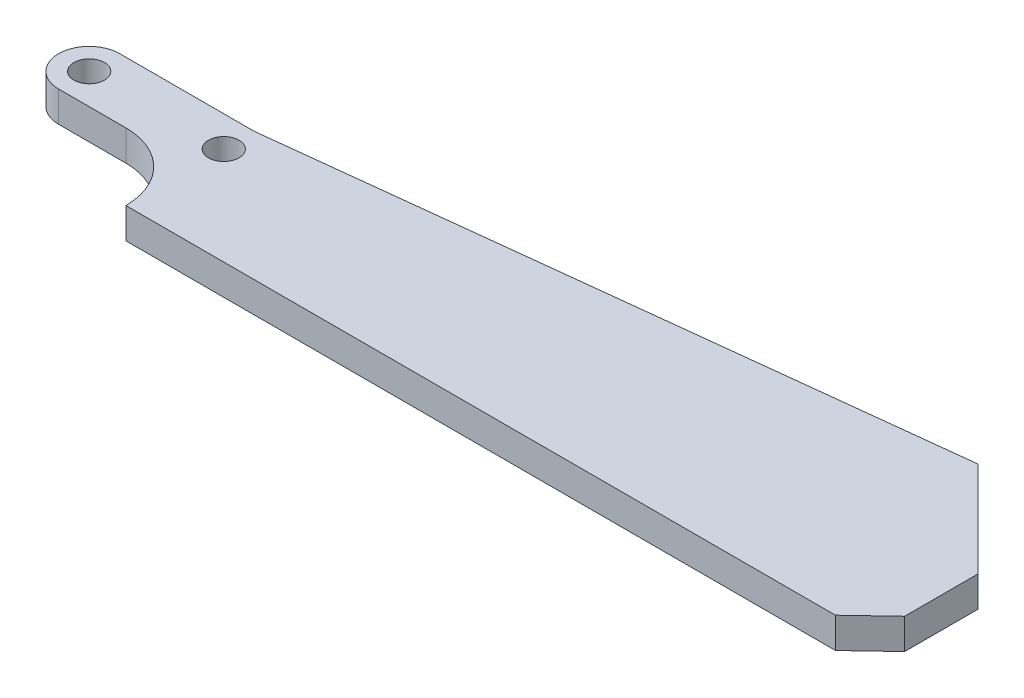
from build123d import *

# Parameters (mm, degrees)
SKETCH_1_R      = 2.5
EXTRUDE_1_DEPTH = 5
FILLET_2_R      = 11
FILLET_3_R      = 11


with BuildPart() as part:
    # 草图1 → 凸台-拉伸1 (new body)
    with BuildSketch(Plane(origin=(0, 0, 0), x_dir=(1, 0, 0), z_dir=(0, 1, 0))):
        with BuildLine():
            Line((11, -5), (-11, -5))
            ThreePointArc((-11, -5), (-16, 0), (-11, 5))
            Line((-11, 5), (11, 5))
            Line((11, 5), (117.253125833, 17.056349186))
            Line((117.253125833, 17.056349186), (120.081552958, 14.227922061))
            Line((120.081552958, 14.227922061), (132.809475019, 1.5))
            Line((132.809475019, 1.5), (132.809475019, -10.5))
            Line((132.809475019, -10.5), (127, -16))
            Line((127, -16), (119, -16))
            Line((119, -16), (19, -16))
            Line((19, -16), (11, -16))
            Line((11, -16), (11, -5))
        make_face()
        with Locations(Location((-11, 0, 0), (0, 0, 270))):
            Circle(SKETCH_1_R, mode=Mode.SUBTRACT)
        with Locations(Location((11, 0, 0), (0, 0, 270))):
            Circle(SKETCH_1_R, mode=Mode.SUBTRACT)
    extrude(amount=EXTRUDE_1_DEPTH)

    # 圆角2
    fillet_2_edges = [part.edges().sort_by_distance(p)[0] for p in [
        (11, 2.5, 5),
    ]]
    fillet(fillet_2_edges, radius=FILLET_2_R - 0.0001)  # a hair under: the kernel refuses the full size

    # 圆角3
    fillet_3_edges = [part.edges().sort_by_distance(p)[0] for p in [
        (11, 2.5, -5),
    ]]
    fillet(fillet_3_edges, radius=FILLET_3_R)


solid = part.part
